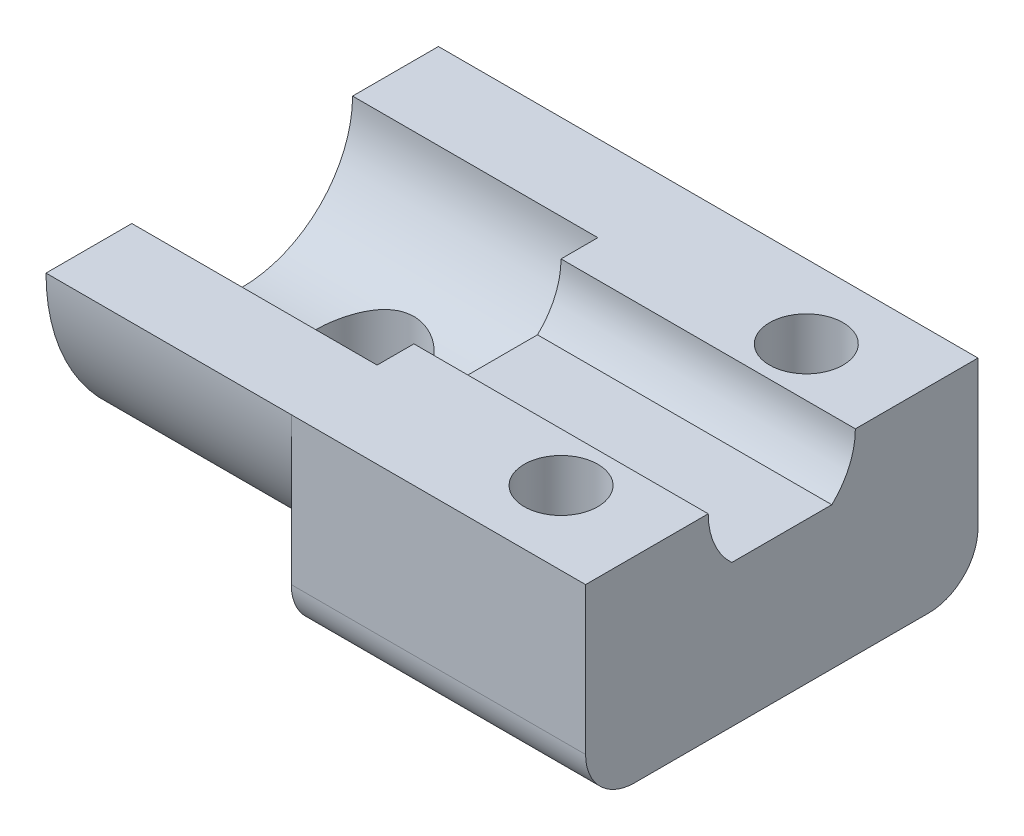
from build123d import *

# Parameters (mm, degrees)
SKETCH_1_W          = 12
SKETCH_1_H          = 16
SKETCH_1_R          = 1.5
EXTRUDE_1_DEPTH     = 8
CUT_EXTRUDE_1_DEPTH = 25
EXTRUDE_2_DEPTH     = 10
FILLET_1_R          = 2
SKETCH_4_R          = 2
CUT_EXTRUDE_2_DEPTH = 20


with BuildPart() as part:
    # 草图1 → 凸台-拉伸1 (new body)
    with BuildSketch(Plane(origin=(0, 0, 0), x_dir=(1, 0, 0), z_dir=(0, 1, 0))):
        Rectangle(SKETCH_1_W, SKETCH_1_H)
        with Locations(Location((2, 5, 0), (0, 0, 270))):
            Circle(SKETCH_1_R, mode=Mode.SUBTRACT)
        with Locations(Location((2, -5, 0), (0, 0, 90))):
            Circle(SKETCH_1_R, mode=Mode.SUBTRACT)
    extrude(amount=EXTRUDE_1_DEPTH)

    # 草图2 → 切除-拉伸1 (cut)
    with BuildSketch(Plane(origin=(6, 0, 0), x_dir=(0, 0, -1), z_dir=(1, 0, 0))):
        with BuildLine():
            Line((-2.039607805, 5.8), (2.039607805, 5.8))
            ThreePointArc((2.039607805, 5.8), (0, 11), (-2.039607805, 5.8))
        make_face()
    extrude(amount=-CUT_EXTRUDE_1_DEPTH, mode=Mode.SUBTRACT)

    # 草图3 → 凸台-拉伸2 (add)
    with BuildSketch(Plane.ZY.offset(6)):
        with BuildLine():
            Line((-8, 8), (-4.5, 8))
            ThreePointArc((-4.5, 8), (0, 3.5), (4.5, 8))
            Line((4.5, 8), (8, 8))
            ThreePointArc((8, 8), (0, 0), (-8, 8))
        make_face()
    extrude(amount=EXTRUDE_2_DEPTH)

    # 圆角1
    # the kernel refuses this fillet: 2 mm, written as the material it takes off along each edge
    with BuildSketch(Plane(origin=(11, 0, 8), x_dir=(0, 0, -1), z_dir=(-1, 0, 0))) as fillet_1_piece_1:
        with BuildLine():
            CenterArc((FILLET_1_R, -FILLET_1_R), FILLET_1_R, 90, 90)
            Line((0, -FILLET_1_R), (0, 0))
            Line((0, 0), (FILLET_1_R, 0))
        make_face()
    extrude(amount=22, mode=Mode.SUBTRACT)
    with BuildSketch(Plane(origin=(-11, 0, -8), x_dir=(0, 1, 0), z_dir=(1, 0, 0))) as fillet_1_piece_2:
        with BuildLine():
            CenterArc((FILLET_1_R, FILLET_1_R), FILLET_1_R, 180, 90)
            Line((0, FILLET_1_R), (0, 0))
            Line((0, 0), (FILLET_1_R, 0))
        make_face()
    extrude(amount=22, mode=Mode.SUBTRACT)

    # 草图4 → 切除-拉伸2 (cut)
    with BuildSketch(Plane(origin=(0, 8, 0), x_dir=(1, 0, 0), z_dir=(0, 1, 0))):
        with Locations(Location((-11, 0, 0), (0, 0, 270))):
            Circle(SKETCH_4_R)
    extrude(amount=-CUT_EXTRUDE_2_DEPTH, mode=Mode.SUBTRACT)


solid = part.part
